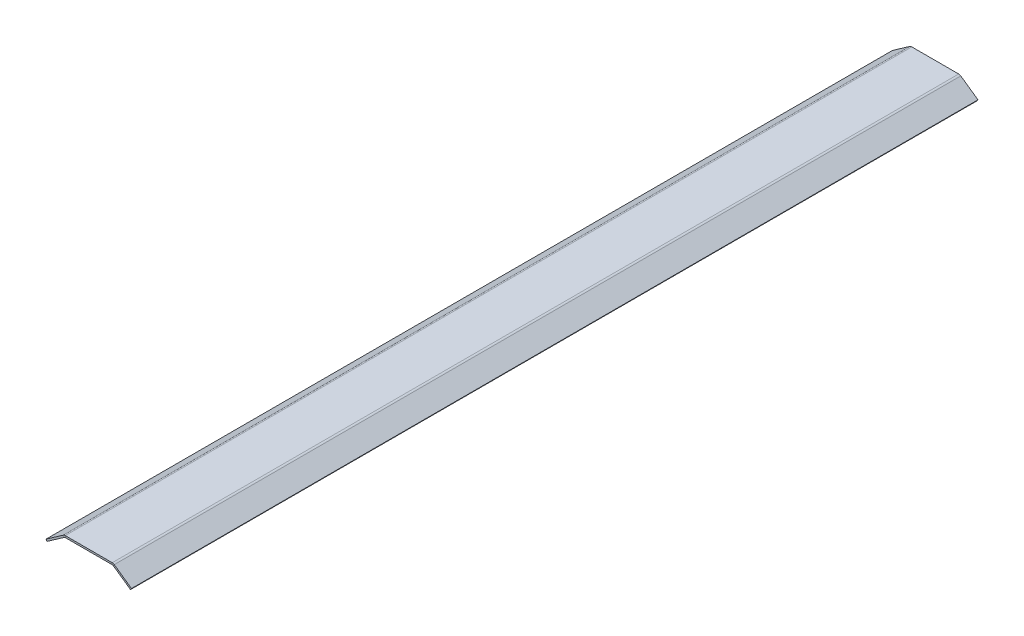
from build123d import *

# Parameters (mm, degrees)
ODGI_CIE_BAZOWE1_DEPTH = 478


# Sheet-metal steps are written as plain solids
with BuildPart() as part:
    # Szkic1 → Odgięcie bazowe1 (new body)
    with BuildSketch(Plane.XY):
        with BuildLine():
            Line((-23.572036047, -7), (-13.833277647, -0.180847956))
            ThreePointArc((-13.833277647, -0.180847956), (-13.560407011, -0.046283049), (-13.259701211, 0))
            Line((-13.259701211, 0), (13.259701211, 0))
            ThreePointArc((13.259701211, 0), (13.560407011, -0.046283049), (13.833277647, -0.180847956))
            Line((13.833277647, -0.180847956), (23.572036047, -7))
            Line((23.572036047, -7), (24.145612484, -6.180847956))
            Line((24.145612484, -6.180847956), (14.406854084, 0.638304089))
            ThreePointArc((14.406854084, 0.638304089), (13.86111281, 0.907433901), (13.259701211, 1))
            Line((13.259701211, 1), (-13.259701211, 1))
            ThreePointArc((-13.259701211, 1), (-13.86111281, 0.907433901), (-14.406854084, 0.638304089))
            Line((-14.406854084, 0.638304089), (-24.145612484, -6.180847956))
            Line((-24.145612484, -6.180847956), (-23.572036047, -7))
        make_face()
    extrude(amount=-ODGI_CIE_BAZOWE1_DEPTH)


solid = part.part
